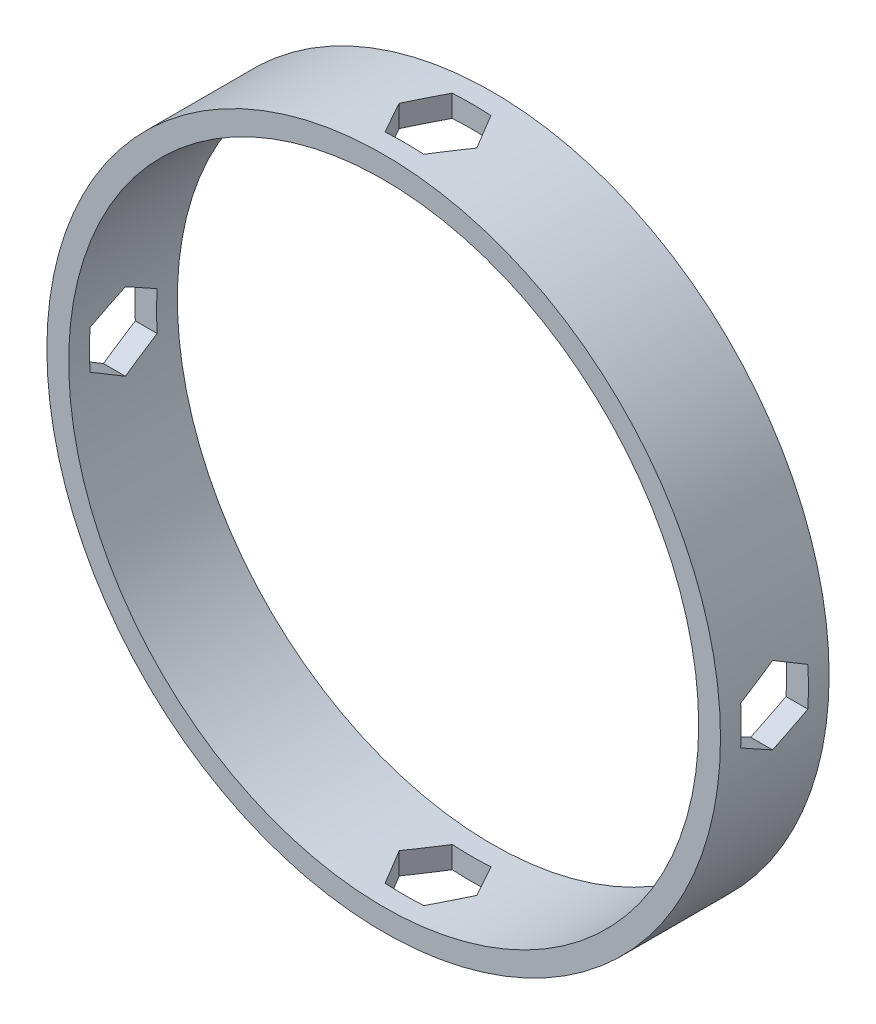
from build123d import *

# Parameters (mm, degrees)
BOSS_EXTRUDE1_DEPTH      = 10.5
BOSS_EXTRUDE1_DEPTH_BACK = 0.5
SKETCH1_R                = 34.11
SKETCH1_R_2              = 31.9
CUT_EXTRUDE1_DEPTH       = 77.991626168
CIRPATTERN2_COUNT        = 2
CIRPATTERN2_ANGLE        = 90


with BuildPart() as part:
    # Sketch1 → Boss-Extrude1 (new, two sides: drawn at the far end of the back side and taken through both)
    with BuildSketch(Plane.XY.offset(-BOSS_EXTRUDE1_DEPTH_BACK)):
        Circle(SKETCH1_R)
        Circle(SKETCH1_R_2, mode=Mode.SUBTRACT)
    extrude(amount=BOSS_EXTRUDE1_DEPTH + BOSS_EXTRUDE1_DEPTH_BACK)

    # Sketch2 → Cut-Extrude1 (cut, through all)
    with BuildSketch(Plane(origin=(0, 34.11, 0), x_dir=(1, 0, 0), z_dir=(0, 1, 0))):
        Polygon((3.92598183, -5), (1.962990915, -1.6), (-1.962990915, -1.6), (-3.92598183, -5), (-1.962990915, -8.4), (1.962990915, -8.4), align=None)
    cut_extrude1 = extrude(amount=-CUT_EXTRUDE1_DEPTH, mode=Mode.SUBTRACT)

    # CirPattern2: Cut-Extrude1 ×2 about axis
    cirpattern2_axis = Axis((0, 0, 10.5), (0, 0, 1))
    for i in range(1, CIRPATTERN2_COUNT):
        add(cut_extrude1.rotate(cirpattern2_axis, i * CIRPATTERN2_ANGLE / (CIRPATTERN2_COUNT - 1)), mode=Mode.SUBTRACT)


solid = part.part
